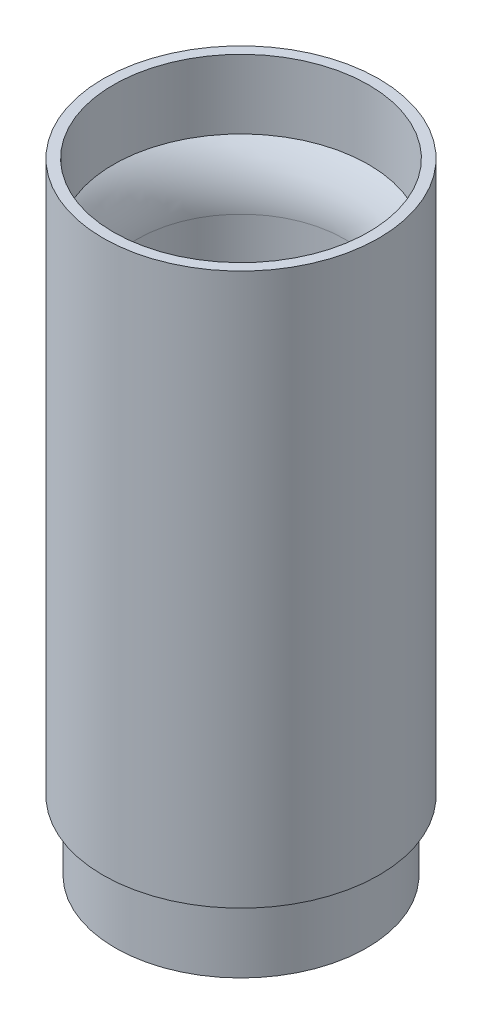
from build123d import *

# Parameters (mm, degrees)
SKETCH_1_R          = 18.25
EXTRUDE_1_DEPTH     = 10
SKETCH_3_R          = 15
CUT_EXTRUDE_1_DEPTH = 8
SKETCH_4_R          = 20
SKETCH_4_R_2        = 15
EXTRUDE_2_DEPTH     = 70
SKETCH_5_R          = 20
SKETCH_5_R_2        = 18.5
EXTRUDE_3_DEPTH     = 10
FILLET_1_R          = 10


with BuildPart() as part:
    # 草图1 → 凸台-拉伸1 (new body)
    with BuildSketch(Plane(origin=(0, 0, 0), x_dir=(1, 0, 0), z_dir=(0, 1, 0))):
        with Locations(Location((0, 0, 0), (0, 0, 270))):
            Circle(SKETCH_1_R)
    extrude(amount=EXTRUDE_1_DEPTH)

    # 草图3 → 切除-拉伸1 (cut)
    with BuildSketch(Plane.XZ):
        with Locations(Location((0, 0, 0), (0, 0, 270))):
            Circle(SKETCH_3_R)
    extrude(amount=-CUT_EXTRUDE_1_DEPTH, mode=Mode.SUBTRACT)

    # 草图4 → 凸台-拉伸2 (add)
    with BuildSketch(Plane(origin=(0, 10, 0), x_dir=(1, 0, 0), z_dir=(0, 1, 0))):
        with Locations(Location((0, 0, 0), (0, 0, 270))):
            Circle(SKETCH_4_R)
        with Locations(Location((0, 0, 0), (0, 0, 90))):
            Circle(SKETCH_4_R_2, mode=Mode.SUBTRACT)
    extrude(amount=EXTRUDE_2_DEPTH)

    # 草图5 → 凸台-拉伸3 (add)
    with BuildSketch(Plane(origin=(0, 80, 0), x_dir=(1, 0, 0), z_dir=(0, 1, 0))):
        with Locations(Location((0, 0, 0), (0, 0, 270))):
            Circle(SKETCH_5_R)
        with Locations(Location((0, 0, 0), (0, 0, 270))):
            Circle(SKETCH_5_R_2, mode=Mode.SUBTRACT)
    extrude(amount=EXTRUDE_3_DEPTH)

    # 圆角1
    # the kernel refuses this fillet: 10 mm, written as the material it takes off along each edge
    with BuildSketch(Plane(origin=(0, 80, 0), x_dir=(0, 0, -1), z_dir=(1, 0, 0))) as fillet_1_piece_1:
        with BuildLine():
            CenterArc((25, -7.599342077), FILLET_1_R, 130.541601874, 49.458398126)
            Line((15, -7.599342077), (14.8, -7.599342077))
            Line((14.8, -7.599342077), (14.8, 0))
            Line((14.8, 0), (15, 0.2))
            ThreePointArc((15, 0.2), (16.75, 0.2), (18.37, 0.151986842))
            Line((18.37, 0.151986842), (18.5, 0))
        make_face()
    revolve(axis=Axis((0, 80, 0), (0, 1, 0)), mode=Mode.SUBTRACT)


solid = part.part
